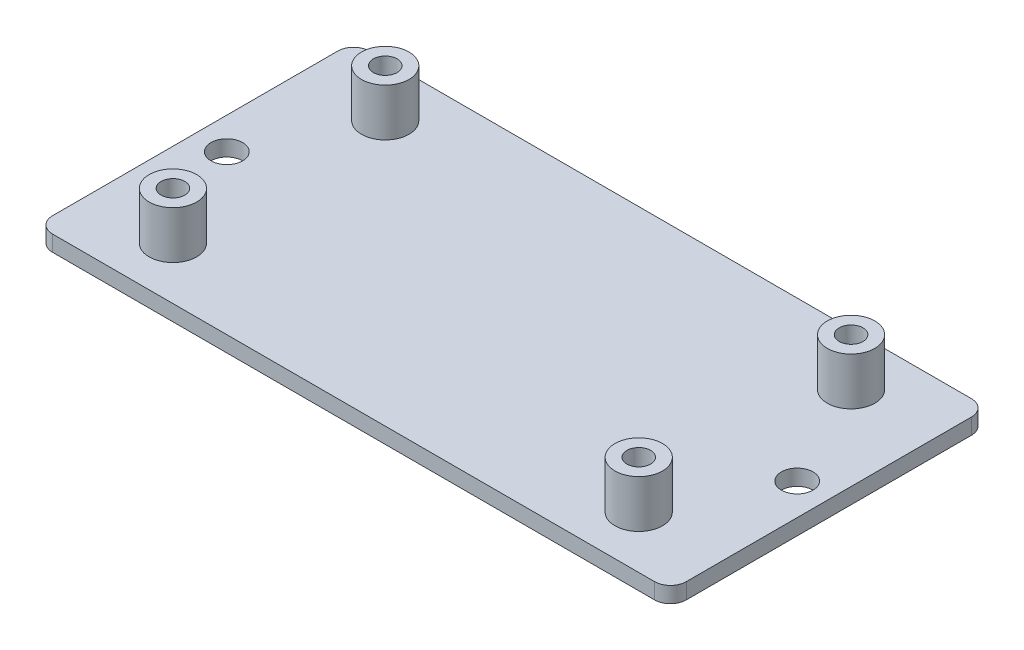
from build123d import *

# Parameters (mm, degrees)
SKETCH_1_W               = 80
SKETCH_1_H               = 40
EXTRUDE_1_DEPTH          = 2
SKETCH_2_R               = 3
EXTRUDE_2_DEPTH          = 6
CUT_EXTRUDE_1_DEPTH      = 90.799777283
CUT_EXTRUDE_1_DEPTH_BACK = 90.799777283
SKETCH_3_R               = 1.5
CUT_EXTRUDE_2_DEPTH      = 90.643739324
CUT_EXTRUDE_2_DEPTH_BACK = 90.643739324
SKETCH_4_R               = 2
FILLET_1_R               = 2
FILLET_2_R               = 2
FILLET_3_R               = 2
FILLET_4_R               = 2


with BuildPart() as part:
    # Эскиз1 → Бобышка-Вытянуть1 (new body)
    with BuildSketch(Plane(origin=(0, 0, 0), x_dir=(1, 0, 0), z_dir=(0, 1, 0))):
        with Locations((40, -20)):
            Rectangle(SKETCH_1_W, SKETCH_1_H)
    extrude(amount=EXTRUDE_1_DEPTH)

    # Эскиз2 → Бобышка-Вытянуть2 (add)
    with BuildSketch(Plane(origin=(0, 2, 0), x_dir=(1, 0, 0), z_dir=(0, 1, 0))):
        with Locations((10.6, -6.6)):
            Circle(SKETCH_2_R)
        with Locations((10.6, -33.4)):
            Circle(SKETCH_2_R)
        with Locations((69.4, -6.6)):
            Circle(SKETCH_2_R)
        with Locations((69.4, -33.4)):
            Circle(SKETCH_2_R)
    extrude(amount=EXTRUDE_2_DEPTH)

    # Эскиз3 → Вырез-Вытянуть1 (cut, two sides: drawn at the far end of the back side and taken through both)
    with BuildSketch(Plane(origin=(0, 8, 0), x_dir=(1, 0, 0), z_dir=(0, 1, 0)).offset(-CUT_EXTRUDE_1_DEPTH_BACK)):
        with Locations((10.6, -6.6)):
            Circle(SKETCH_3_R)
        with Locations((10.6, -33.4)):
            Circle(SKETCH_3_R)
        with Locations((69.4, -6.6)):
            Circle(SKETCH_3_R)
        with Locations((69.4, -33.4)):
            Circle(SKETCH_3_R)
    extrude(amount=CUT_EXTRUDE_1_DEPTH + CUT_EXTRUDE_1_DEPTH_BACK, mode=Mode.SUBTRACT)

    # Эскиз4 → Вырез-Вытянуть2 (cut, two sides: drawn at the far end of the back side and taken through both)
    with BuildSketch(Plane(origin=(0, 2, 0), x_dir=(1, 0, 0), z_dir=(0, 1, 0)).offset(-CUT_EXTRUDE_2_DEPTH_BACK)):
        with Locations((4, -20)):
            Circle(SKETCH_4_R)
        with Locations((76, -20)):
            Circle(SKETCH_4_R)
    extrude(amount=CUT_EXTRUDE_2_DEPTH + CUT_EXTRUDE_2_DEPTH_BACK, mode=Mode.SUBTRACT)

    # Скругление1
    fillet_1_edges = [part.edges().sort_by_distance(p)[0] for p in [
        (0, 1, 0),
    ]]
    fillet(fillet_1_edges, radius=FILLET_1_R)

    # Скругление2
    fillet_2_edges = [part.edges().sort_by_distance(p)[0] for p in [
        (0, 1, 40),
    ]]
    fillet(fillet_2_edges, radius=FILLET_2_R)

    # Скругление3
    fillet_3_edges = [part.edges().sort_by_distance(p)[0] for p in [
        (80, 1, 40),
    ]]
    fillet(fillet_3_edges, radius=FILLET_3_R)

    # Скругление4
    fillet_4_edges = [part.edges().sort_by_distance(p)[0] for p in [
        (80, 1, 0),
    ]]
    fillet(fillet_4_edges, radius=FILLET_4_R)


solid = part.part
